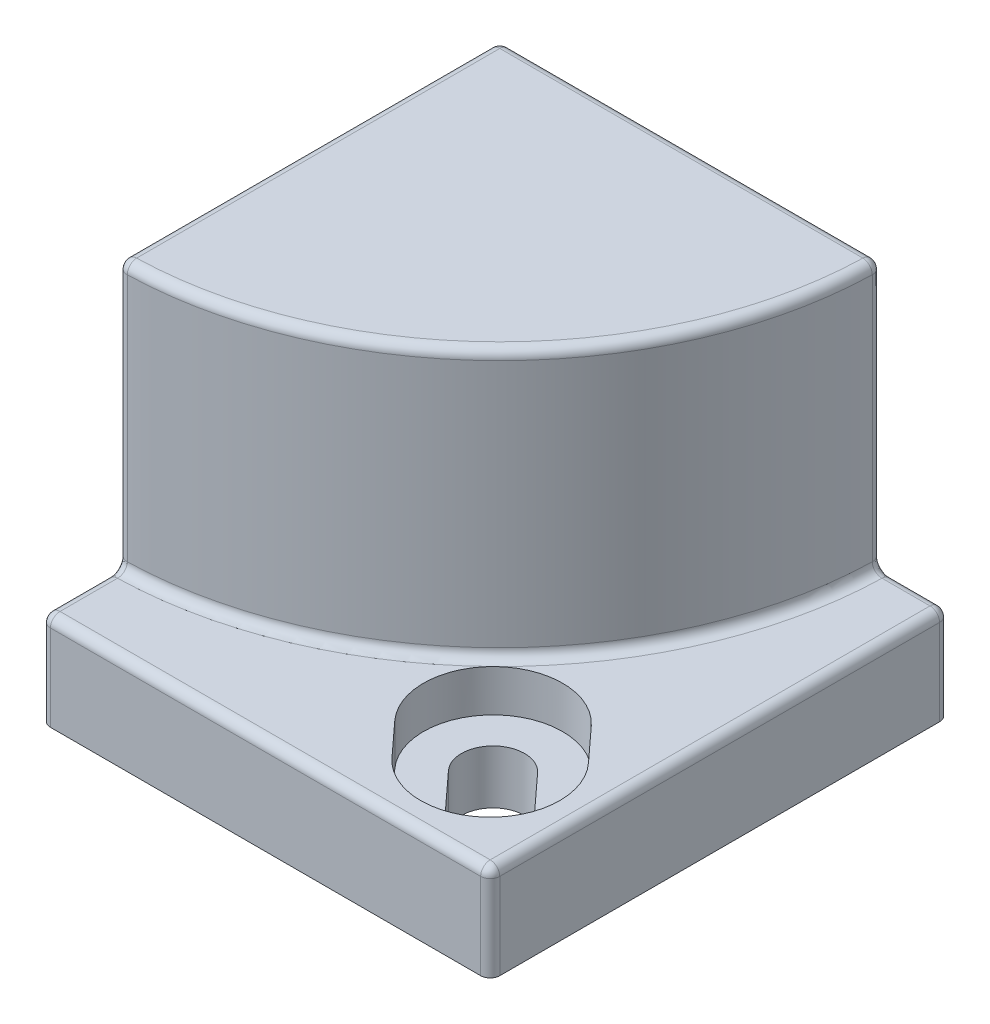
from build123d import *

# Parameters (mm, degrees)
SKETCH3_W                               = 47
SKETCH3_H                               = 48
BOSS_EXTRUDE1_DEPTH                     = 10
CBORE_FOR_M6_HEX_HEAD_BOLT1_D           = 6.6
CBORE_FOR_M6_HEX_HEAD_BOLT1_CBORE_D     = 14.55
CBORE_FOR_M6_HEX_HEAD_BOLT1_CBORE_DEPTH = 4.38
BOSS_EXTRUDE3_DEPTH                     = 18
BOSS_EXTRUDE4_DEPTH                     = 10
SKETCH10_R                              = 3
CUT_EXTRUDE2_DEPTH                      = 6
FILLET1_R                               = 1
CUT_EXTRUDE3_DEPTH                      = 4.38
CUT_EXTRUDE4_DEPTH                      = 47.655272044
FILLET2_R                               = 1


with BuildPart() as part:
    # Sketch3 → Boss-Extrude1 (new body)
    with BuildSketch(Plane(origin=(0, 0, 0), x_dir=(1, 0, 0), z_dir=(0, 1, 0))):
        Rectangle(SKETCH3_W, SKETCH3_H)
    extrude(amount=BOSS_EXTRUDE1_DEPTH)

    # CBORE for M6 Hex Head Bolt1 (through all)
    with Locations(Plane(origin=(0, 10, 0), x_dir=(1, 0, 0), z_dir=(0, 1, 0))):
        with Locations((13.5, -14)):
            CounterBoreHole(CBORE_FOR_M6_HEX_HEAD_BOLT1_D / 2, CBORE_FOR_M6_HEX_HEAD_BOLT1_CBORE_D / 2, CBORE_FOR_M6_HEX_HEAD_BOLT1_CBORE_DEPTH)

    # Sketch8 → Boss-Extrude3 (add)
    with BuildSketch(Plane(origin=(0, 10, 0), x_dir=(1, 0, 0), z_dir=(0, 1, 0))):
        with BuildLine():
            Line((16.5, 24), (6.5, 24))
            ThreePointArc((6.5, 24), (-2.286796564, 2.786796564), (-23.5, -6))
            Line((-23.5, -6), (-23.5, -16))
            ThreePointArc((-23.5, -16), (4.784271247, -4.284271247), (16.5, 24))
        make_face()
    extrude(amount=BOSS_EXTRUDE3_DEPTH)

    # Sketch9 → Boss-Extrude4 (add)
    with BuildSketch(Plane(origin=(0, 28, 0), x_dir=(1, 0, 0), z_dir=(0, 1, 0))):
        with BuildLine():
            Line((16.5, 24), (-23.5, 24))
            Line((-23.5, 24), (-23.5, -16))
            ThreePointArc((-23.5, -16), (4.784271247, -4.284271247), (16.5, 24))
        make_face()
    extrude(amount=BOSS_EXTRUDE4_DEPTH)

    # Sketch10 → Cut-Extrude2 (cut)
    with BuildSketch(Plane(origin=(0, 10, 0), x_dir=(1, 0, 0), z_dir=(0, 1, 0))):
        with Locations(Location((-11, 11.5, 0), (0, 0, 270))):
            Circle(SKETCH10_R)
    extrude(amount=-CUT_EXTRUDE2_DEPTH, mode=Mode.SUBTRACT)

    # Fillet1
    fillet1_edges = [part.edges().sort_by_distance(p)[0] for p in [
        (-8.5, 28, -24),
        (-8.5, 10, -24),
        (-23.5, 28, -9),
        (-23.5, 10, -9),
        (-23.5, 10, 20),
        (20, 10, -24),
        (6.5, 19, -24),
        (-2.286796564, 28, -2.786796564),
        (-23.5, 19, 6),
        (-2.286796564, 10, -2.786796564),
        (-3.5, 38, -24),
        (-23.5, 38, -4),
        (-23.5, 24, 16),
        (4.784271247, 38, 4.284271247),
        (16.5, 24, -24),
        (4.784271247, 10, 4.284271247),
        (-23.5, 33, -24),
        (23.5, 10, 0),
        (0, 10, 24),
    ]]
    fillet(fillet1_edges, radius=FILLET1_R)

    # Sketch11 → Cut-Extrude3 (cut)
    with BuildSketch(Plane(origin=(0, 10, 0), x_dir=(1, 0, 0), z_dir=(0, 1, 0))):
        with BuildLine():
            Line((4.917076181, -15.401936099), (8.136440966, -18.915064546))
            ThreePointArc((8.136440966, -18.915064546), (18.415064546, -19.363559034), (18.863559034, -9.084935454))
            Line((18.863559034, -9.084935454), (15.644194248, -5.571807007))
            ThreePointArc((15.644194248, -5.571807007), (5.365570669, -5.123312519), (4.917076181, -15.401936099))
        make_face()
    extrude(amount=-CUT_EXTRUDE3_DEPTH, mode=Mode.SUBTRACT)

    # Sketch12 → Cut-Extrude4 (cut, through all)
    with BuildSketch(Plane(origin=(0, 5.62, 0), x_dir=(1, 0, 0), z_dir=(0, 1, 0))):
        with BuildLine():
            Line((7.847680601, -12.716385367), (11.067045387, -16.229513815))
            ThreePointArc((11.067045387, -16.229513815), (15.729513815, -16.432954613), (15.932954613, -11.770486185))
            Line((15.932954613, -11.770486185), (12.713589828, -8.257357738))
            ThreePointArc((12.713589828, -8.257357738), (8.0511214, -8.05391694), (7.847680601, -12.716385367))
        make_face()
    extrude(amount=-CUT_EXTRUDE4_DEPTH, mode=Mode.SUBTRACT)

    # Fillet2
    # the kernel refuses this fillet: 1 mm, written as the material it takes off along each edge
    with BuildSketch(Plane(origin=(22.5, 9, 23), x_dir=(1, 0, 0), z_dir=(0, 0, 1))) as fillet2_piece_1_section:
        Polygon((0, 0), (FILLET2_R, 0), (FILLET2_R, FILLET2_R), (0, FILLET2_R), align=None)
    fillet2_piece_1 = extrude(amount=FILLET2_R, mode=Mode.PRIVATE)
    fillet2_piece_1 = fillet2_piece_1 - Plane(origin=(22.5, 9, 23), x_dir=(-0.7071067811865475, -0.7071067811865475, 0), z_dir=(0, 0, 1)) * Sphere(FILLET2_R, mode=Mode.PRIVATE)
    add(fillet2_piece_1, mode=Mode.SUBTRACT)
    with BuildSketch(Plane(origin=(22.5, 9, -23), x_dir=(0, 0, -1), z_dir=(1, 0, 0))) as fillet2_piece_2_section:
        Polygon((0, 0), (FILLET2_R, 0), (FILLET2_R, FILLET2_R), (0, FILLET2_R), align=None)
    fillet2_piece_2 = extrude(amount=FILLET2_R, mode=Mode.PRIVATE)
    fillet2_piece_2 = fillet2_piece_2 - Plane(origin=(22.5, 9, -23), x_dir=(0, -0.7071067811865475, 0.7071067811865475), z_dir=(1, 0, 0)) * Sphere(FILLET2_R, mode=Mode.PRIVATE)
    add(fillet2_piece_2, mode=Mode.SUBTRACT)
    with BuildSketch(Plane(origin=(-22.5, 9, 23), x_dir=(-1, 0, 0), z_dir=(0, 0, 1))) as fillet2_piece_3_section:
        Polygon((0, 0), (FILLET2_R, 0), (FILLET2_R, -FILLET2_R), (0, -FILLET2_R), align=None)
    fillet2_piece_3 = extrude(amount=FILLET2_R, mode=Mode.PRIVATE)
    fillet2_piece_3 = fillet2_piece_3 - Plane(origin=(-22.5, 9, 23), x_dir=(0.7071067811865475, -0.7071067811865475, 0), z_dir=(0, 0, 1)) * Sphere(FILLET2_R, mode=Mode.PRIVATE)
    add(fillet2_piece_3, mode=Mode.SUBTRACT)
    with BuildSketch(Plane(origin=(-22.5, 9, -23), x_dir=(0, 0, -1), z_dir=(-1, 0, 0))) as fillet2_piece_4_section:
        Polygon((0, 0), (FILLET2_R, 0), (FILLET2_R, -FILLET2_R), (0, -FILLET2_R), align=None)
    fillet2_piece_4 = extrude(amount=FILLET2_R, mode=Mode.PRIVATE)
    fillet2_piece_4 = fillet2_piece_4 - Plane(origin=(-22.5, 9, -23), x_dir=(0, -0.7071067811865475, 0.7071067811865475), z_dir=(-1, 0, 0)) * Sphere(FILLET2_R, mode=Mode.PRIVATE)
    add(fillet2_piece_4, mode=Mode.SUBTRACT)
    with BuildSketch(Plane(origin=(-23.5, -2.5, -24), x_dir=(0, 0, 1), z_dir=(0, 1, 0)), Plane(origin=(-23.5, -2.5, 24), x_dir=(1, 0, 0), z_dir=(0, 1, 0))) as fillet2_piece_5:
        with BuildLine():
            CenterArc((FILLET2_R, FILLET2_R), FILLET2_R, 180, 90)
            Line((0, FILLET2_R), (0, 0))
            Line((0, 0), (FILLET2_R, 0))
        make_face()
    extrude(amount=11.5, mode=Mode.SUBTRACT)
    with BuildSketch(Plane(origin=(23.5, -2.5, -24), x_dir=(0, 0, 1), z_dir=(0, 1, 0)), Plane(origin=(23.5, -2.5, 24), x_dir=(-1, 0, 0), z_dir=(0, 1, 0))) as fillet2_piece_6:
        with BuildLine():
            CenterArc((FILLET2_R, -FILLET2_R), FILLET2_R, 90, 90)
            Line((0, -FILLET2_R), (0, 0))
            Line((0, 0), (FILLET2_R, 0))
        make_face()
    extrude(amount=11.5, mode=Mode.SUBTRACT)


solid = part.part
